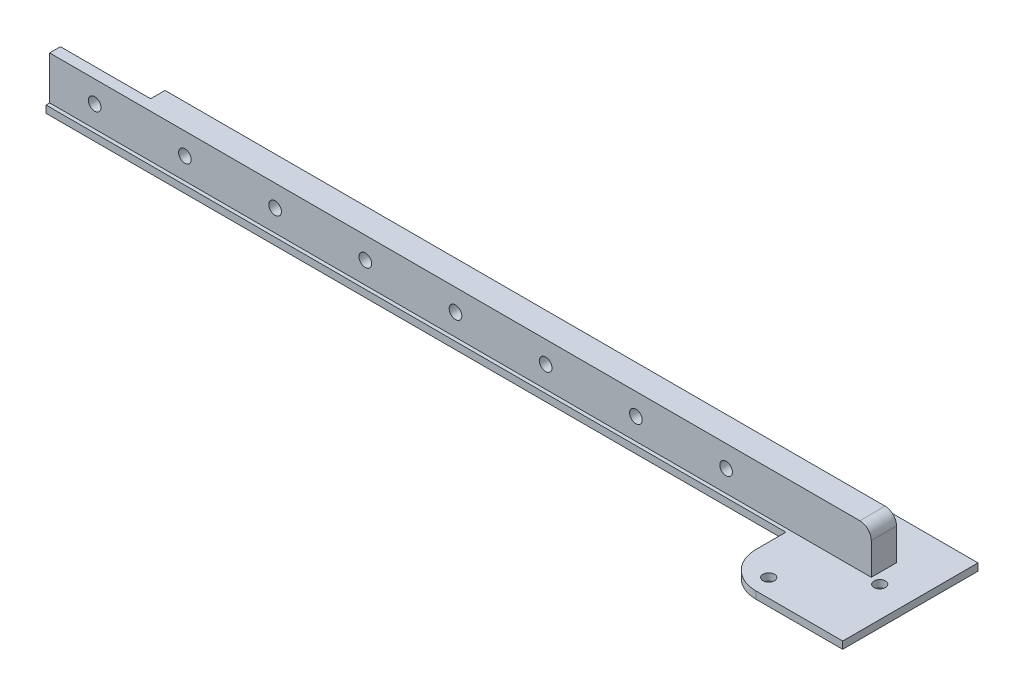
from build123d import *

# Parameters (mm, degrees)
TOPSKETCH1_R                        = 1.59
TOPBOSS_EXTRUDE1_DEPTH              = 2
FILLET1_R                           = 10
LINEARRAILHEIGHTSKETCH2_W           = 227.746666667
LINEARRAILHEIGHTSKETCH2_H           = 7
LINEARRAILHEIGHTBOSS_EXTRUDE2_DEPTH = 12
LINEARRAILHOLESSKETCH3_R            = 1.75
LINEARRAILHOLESCUT_EXTRUDE1_DEPTH   = 207.456699819
CONNECTINGPLATESKETCH2_W            = 25
CONNECTINGPLATESKETCH2_H            = 14
CONNECTINGPLATECUT_EXTRUDE1_DEPTH   = 4
FILLET2_R                           = 3.175
NUTHOLECUT_EXTRUDE1_DEPTH           = 2


with BuildPart() as part:
    # TopSketch1 → TopBoss-Extrude1 (new body)
    with BuildSketch(Plane(origin=(0, 0, 0), x_dir=(1, 0, 0), z_dir=(0, 1, 0))):
        Polygon((0, 0), (34, 0), (34, 37.5), (0, 37.5), (0, 26.25), (-205.08, 26.25), (-205.08, 18.25), (0, 18.25), align=None)
        with Locations((8.5, 32.5)):
            Circle(TOPSKETCH1_R, mode=Mode.SUBTRACT)
        with Locations((8.5, 5)):
            Circle(TOPSKETCH1_R, mode=Mode.SUBTRACT)
        with Locations((25.5, 18.75)):
            Circle(TOPSKETCH1_R, mode=Mode.SUBTRACT)
    extrude(amount=TOPBOSS_EXTRUDE1_DEPTH)

    # Fillet1
    fillet1_edges = [part.edges().sort_by_distance(p)[0] for p in [
        (0, 1, 0),
        (0, 1, -37.5),
    ]]
    fillet(fillet1_edges, radius=FILLET1_R)

    # LinearRailHEightSketch2 → LinearRailHeightBoss-Extrude2 (add)
    with BuildSketch(Plane(origin=(0, 2, 0), x_dir=(1, 0, 0), z_dir=(0, 1, 0))):
        with Locations((-91.206666667, 22.75)):
            Rectangle(LINEARRAILHEIGHTSKETCH2_W, LINEARRAILHEIGHTSKETCH2_H)
    extrude(amount=LINEARRAILHEIGHTBOSS_EXTRUDE2_DEPTH)

    # LinearRailHolesSketch3 → LinearRailHolesCut-Extrude1 (cut, through all)
    with BuildSketch(Plane.XY.offset(-19.25)):
        with Locations((-192.58, 8)):
            Circle(LINEARRAILHOLESSKETCH3_R)
        with Locations((-167.58, 8)):
            Circle(LINEARRAILHOLESSKETCH3_R)
        with Locations((-142.58, 8)):
            Circle(LINEARRAILHOLESSKETCH3_R)
        with Locations((-117.58, 8)):
            Circle(LINEARRAILHOLESSKETCH3_R)
        with Locations((-92.58, 8)):
            Circle(LINEARRAILHOLESSKETCH3_R)
        with Locations((-67.58, 8)):
            Circle(LINEARRAILHOLESSKETCH3_R)
        with Locations((-42.58, 8)):
            Circle(LINEARRAILHOLESSKETCH3_R)
        with Locations((-17.58, 8)):
            Circle(LINEARRAILHOLESSKETCH3_R)
    extrude(amount=-LINEARRAILHOLESCUT_EXTRUDE1_DEPTH, mode=Mode.SUBTRACT)

    # ConnectingPlateSketch2 → ConnectingPlateCut-Extrude1 (cut)
    with BuildSketch(Plane(origin=(0, 0, -26.25), x_dir=(-1, 0, 0), z_dir=(0, 0, -1))):
        with Locations((192.58, 7)):
            Rectangle(CONNECTINGPLATESKETCH2_W, CONNECTINGPLATESKETCH2_H)
    extrude(amount=-CONNECTINGPLATECUT_EXTRUDE1_DEPTH, mode=Mode.SUBTRACT)

    # Fillet2
    fillet2_edges = [part.edges().sort_by_distance(p)[0] for p in [
        (22.666666667, 14, -22.75),
    ]]
    fillet(fillet2_edges, radius=FILLET2_R)

    # NutHoleSketch1 → NutHoleCut-Extrude1 (cut)
    with BuildSketch(Plane(origin=(0, 0, -26.25), x_dir=(-1, 0, 0), z_dir=(0, 0, -1))):
        Polygon((19.13, 5.315321248), (20.68, 8), (19.13, 10.684678752), (16.03, 10.684678752), (14.48, 8), (16.03, 5.315321248), align=None)
        Polygon((44.13, 5.315321248), (45.68, 8), (44.13, 10.684678752), (41.03, 10.684678752), (39.48, 8), (41.03, 5.315321248), align=None)
        Polygon((69.13, 5.315321248), (70.68, 8), (69.13, 10.684678752), (66.03, 10.684678752), (64.48, 8), (66.03, 5.315321248), align=None)
        Polygon((94.13, 5.315321248), (95.68, 8), (94.13, 10.684678752), (91.03, 10.684678752), (89.48, 8), (91.03, 5.315321248), align=None)
        Polygon((119.13, 5.315321248), (120.68, 8), (119.13, 10.684678752), (116.03, 10.684678752), (114.48, 8), (116.03, 5.315321248), align=None)
        Polygon((144.13, 5.315321248), (145.68, 8), (144.13, 10.684678752), (141.03, 10.684678752), (139.48, 8), (141.03, 5.315321248), align=None)
        Polygon((169.13, 5.315321248), (170.68, 8), (169.13, 10.684678752), (166.03, 10.684678752), (164.48, 8), (166.03, 5.315321248), align=None)
    extrude(amount=-NUTHOLECUT_EXTRUDE1_DEPTH, mode=Mode.SUBTRACT)


solid = part.part
